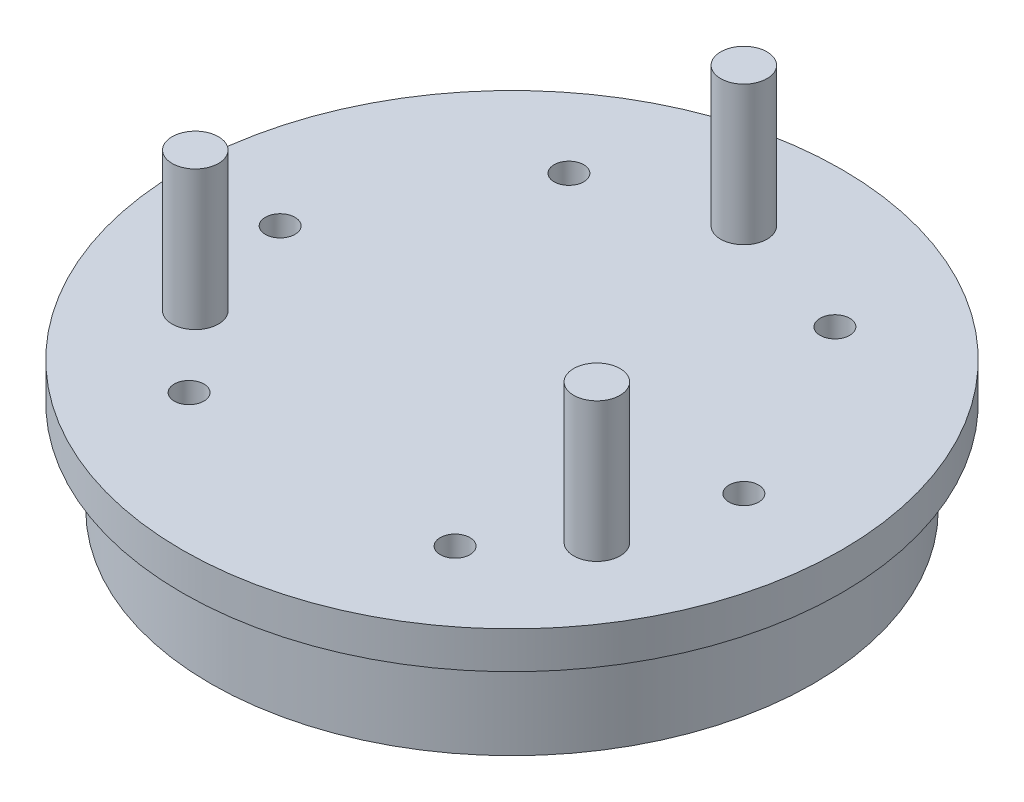
from build123d import *

# Parameters (mm, degrees)
SKETCH3_R           = 35.55
BOSS_EXTRUDE1_DEPTH = 4
SKETCH4_R           = 2.5
BOSS_EXTRUDE2_DEPTH = 15
SKETCH6_R           = 32.5
BOSS_EXTRUDE4_DEPTH = 10
SKETCH7_R           = 1.6
CUT_EXTRUDE1_DEPTH  = 59.039684699


with BuildPart() as part:
    # Sketch3 → Boss-Extrude1 (new body)
    with BuildSketch(Plane(origin=(0, 0, 0), x_dir=(1, 0, 0), z_dir=(0, 1, 0))):
        Circle(SKETCH3_R)
    extrude(amount=BOSS_EXTRUDE1_DEPTH)

    # Sketch4 → Boss-Extrude2 (add)
    with BuildSketch(Plane(origin=(0, 4, 0), x_dir=(1, 0, 0), z_dir=(0, 1, 0))):
        with Locations((0, 25)):
            Circle(SKETCH4_R)
        with Locations((21.650635095, -12.5)):
            Circle(SKETCH4_R)
        with Locations((-21.650635095, -12.5)):
            Circle(SKETCH4_R)
    extrude(amount=BOSS_EXTRUDE2_DEPTH)

    # Sketch6 → Boss-Extrude4 (add)
    with BuildSketch(Plane.XZ):
        Circle(SKETCH6_R)
    extrude(amount=BOSS_EXTRUDE4_DEPTH)

    # Sketch7 → Cut-Extrude1 (cut, through all)
    with BuildSketch(Plane.XZ.offset(10)):
        with Locations((-25, 0)):
            Circle(SKETCH7_R)
        with Locations((25, 0)):
            Circle(SKETCH7_R)
        with Locations((-14.339410909, -20.478801107)):
            Circle(SKETCH7_R)
        with Locations((14.339410909, -20.478801107)):
            Circle(SKETCH7_R)
        with Locations((-14.339410909, 20.478801107)):
            Circle(SKETCH7_R)
        with Locations((14.339410909, 20.478801107)):
            Circle(SKETCH7_R)
    extrude(amount=-CUT_EXTRUDE1_DEPTH, mode=Mode.SUBTRACT)


solid = part.part
